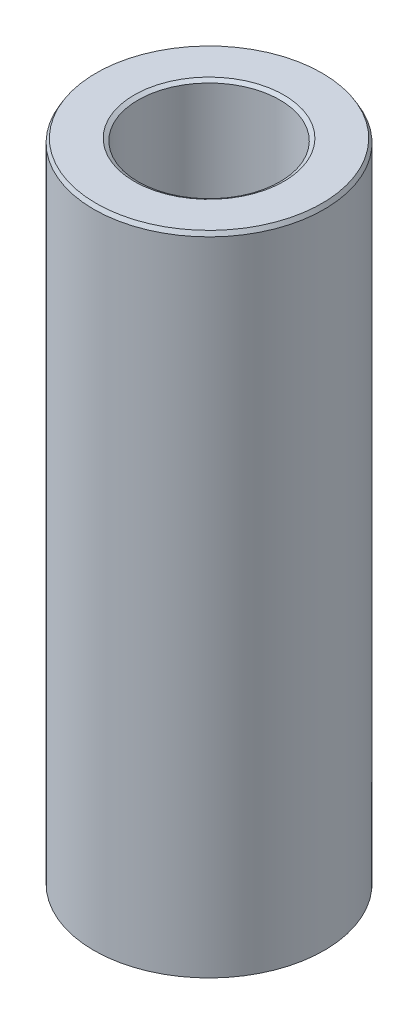
from build123d import *
from OCP.BRepFilletAPI import BRepFilletAPI_MakeChamfer

# Parameters (mm, degrees)
SKETCH1_R           = 47.5
BOSS_EXTRUDE1_DEPTH = 267.124461435
SKETCH2_R           = 29.219674434
CUT_EXTRUDE1_DEPTH  = 276.441423712
CHAMFER1_SIZE       = 1.648417183
CHAMFER1_SIZE2      = 0.951714105


with BuildPart() as part:
    # Sketch1 → Boss-Extrude1 (new body)
    with BuildSketch(Plane(origin=(0, 0, 0), x_dir=(1, 0, 0), z_dir=(0, 1, 0))):
        Circle(SKETCH1_R)
    extrude(amount=BOSS_EXTRUDE1_DEPTH)

    # Sketch2 → Cut-Extrude1 (cut, through all)
    with BuildSketch(Plane(origin=(0, 0, 0), x_dir=(1, 0, 0), z_dir=(0, 1, 0))):
        Circle(SKETCH2_R)
    extrude(amount=CUT_EXTRUDE1_DEPTH, mode=Mode.SUBTRACT)

    # Chamfer1: one chamfer whose edges measure the first distance from different faces: ONE call of the kernel's chamfer builder (chamfer() names one face for all edges)
    chamfer1_edges_1 = [part.edges().sort_by_distance(p)[0] for p in [
        (-29.219674434, 267.124461435, 0),
    ]]
    chamfer1_side_1 = [part.faces().sort_by_distance(p)[0] for p in [
        (-46.156497116, 267.124461435, 0),
    ]]
    chamfer1_edges_2 = [part.edges().sort_by_distance(p)[0] for p in [
        (-29.219674434, 0, 0),
    ]]
    chamfer1_side_2 = [part.faces().sort_by_distance(p)[0] for p in [
        (-29.219674434, 133.562230717, 0),
    ]]
    chamfer1_edges_3 = [part.edges().sort_by_distance(p)[0] for p in [
        (-47.5, 0, 0),
    ]]
    chamfer1_side_3 = [part.faces().sort_by_distance(p)[0] for p in [
        (-46.156497116, 0, 0),
    ]]
    chamfer1_edges_4 = [part.edges().sort_by_distance(p)[0] for p in [
        (-47.5, 267.124461435, 0),
    ]]
    chamfer1_side_4 = [part.faces().sort_by_distance(p)[0] for p in [
        (-47.5, 133.562230717, 0),
    ]]
    chamfer1 = BRepFilletAPI_MakeChamfer(part.part.solid().wrapped)
    for e in chamfer1_edges_1:
        chamfer1.Add(CHAMFER1_SIZE, CHAMFER1_SIZE2, e.wrapped, chamfer1_side_1[0].wrapped)  # the first distance lies on this face
    for e in chamfer1_edges_2:
        chamfer1.Add(CHAMFER1_SIZE, CHAMFER1_SIZE2, e.wrapped, chamfer1_side_2[0].wrapped)  # the first distance lies on this face
    for e in chamfer1_edges_3:
        chamfer1.Add(CHAMFER1_SIZE, CHAMFER1_SIZE2, e.wrapped, chamfer1_side_3[0].wrapped)  # the first distance lies on this face
    for e in chamfer1_edges_4:
        chamfer1.Add(CHAMFER1_SIZE, CHAMFER1_SIZE2, e.wrapped, chamfer1_side_4[0].wrapped)  # the first distance lies on this face
    add(Compound.cast(chamfer1.Shape()), mode=Mode.REPLACE)


solid = part.part
